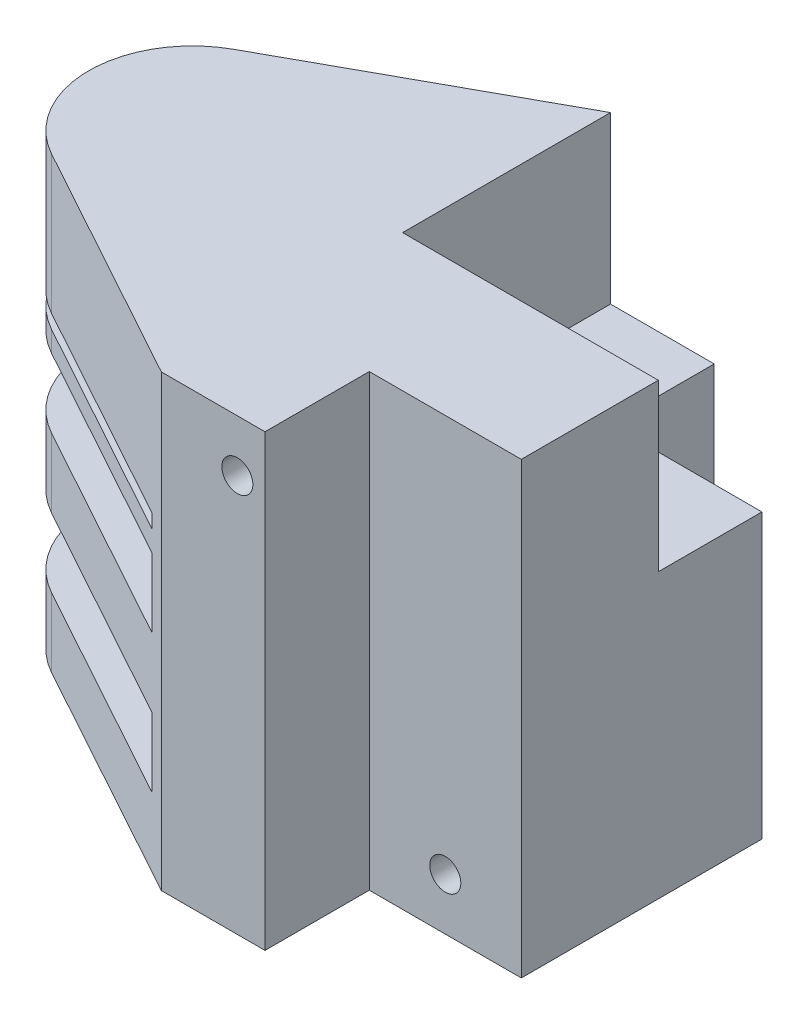
from build123d import *

# Parameters (mm, degrees)
SKETCH1_W               = 80
SKETCH1_H               = 65
BOSS_EXTRUDE1_DEPTH     = 65
SKETCH3_W               = 22
SKETCH3_H               = 15.09
CUT_EXTRUDE1_DEPTH      = 65.72
CUT_EXTRUDE2_DEPTH      = 20
CUT_EXTRUDE2_DEPTH_BACK = 55.72
SKETCH4_R               = 2.24505
SKETCH4_R_2             = 2.245
SKETCH5_W               = 65
SKETCH5_H               = 10
SKETCH5_H_2             = 2
CUT_EXTRUDE3_DEPTH      = 40
SKETCH23_W              = 37
SKETCH23_H              = 30.09
CUT_EXTRUDE15_DEPTH     = 24
CUT_EXTRUDE4_DEPTH      = 65
SKETCH10_R              = 1
CUT_EXTRUDE6_DEPTH      = 42


with BuildPart() as part:
    # Sketch1 → Boss-Extrude1 (new body)
    with BuildSketch(Plane.XY):
        with Locations((40, 32.5)):
            Rectangle(SKETCH1_W, SKETCH1_H)
    extrude(amount=BOSS_EXTRUDE1_DEPTH)

    # Sketch3 → Cut-Extrude1 (cut)
    with BuildSketch(Plane.XZ):
        with Locations((69, 57.455)):
            Rectangle(SKETCH3_W, SKETCH3_H)
        with Locations((69, 7.545)):
            Rectangle(SKETCH3_W, SKETCH3_H)
    extrude(amount=-CUT_EXTRUDE1_DEPTH, mode=Mode.SUBTRACT)

    # Sketch4 → Cut-Extrude2 (cut, two sides: drawn at the far end of the back side and taken through both)
    with BuildSketch(Plane.XY.offset(49.91).offset(-CUT_EXTRUDE2_DEPTH_BACK)):
        with Locations((69, 7.5)):
            Circle(SKETCH4_R)
        with Locations((54, 57.5)):
            Circle(SKETCH4_R_2)
    extrude(amount=CUT_EXTRUDE2_DEPTH + CUT_EXTRUDE2_DEPTH_BACK, mode=Mode.SUBTRACT)

    # Sketch5 → Cut-Extrude3 (cut)
    with BuildSketch(Plane.ZY):
        with Locations((32.5, 15)):
            Rectangle(SKETCH5_W, SKETCH5_H)
        with Locations((32.5, 35)):
            Rectangle(SKETCH5_W, SKETCH5_H)
        with Locations((32.5, 44)):
            Rectangle(SKETCH5_W, SKETCH5_H_2)
    extrude(amount=-CUT_EXTRUDE3_DEPTH, mode=Mode.SUBTRACT)

    # Sketch23 → Cut-Extrude15 (cut)
    with BuildSketch(Plane(origin=(0, 65, 0), x_dir=(1, 0, 0), z_dir=(0, 1, 0))):
        with Locations((61.5, -15.045)):
            Rectangle(SKETCH23_W, SKETCH23_H)
    extrude(amount=-CUT_EXTRUDE15_DEPTH, mode=Mode.SUBTRACT)

    # Sketch6 → Cut-Extrude4 (cut)
    with BuildSketch(Plane.XZ):
        with BuildLine():
            Line((0, 0), (43, 0))
            Line((43, 0), (7.776682895, 19.353757571))
            ThreePointArc((7.776682895, 19.353757571), (2.089737482, 24.862911437), (0, 32.5))
            Line((0, 32.5), (0, 0))
        make_face()
        with BuildLine():
            Line((0, 65), (0, 32.5))
            ThreePointArc((0, 32.5), (2.089737482, 40.137088563), (7.776682895, 45.646242429))
            Line((7.776682895, 45.646242429), (43, 65))
            Line((43, 65), (0, 65))
        make_face()
    extrude(amount=-CUT_EXTRUDE4_DEPTH, mode=Mode.SUBTRACT)

    # Sketch10 → Cut-Extrude6 (cut)
    with BuildSketch(Plane.XZ):
        with Locations((15, 32.5)):
            Circle(SKETCH10_R)
    extrude(amount=-CUT_EXTRUDE6_DEPTH, mode=Mode.SUBTRACT)


with BuildPart() as part_1:
    # Body-Move/Copy1: moved
    add(part.part.moved(Location((-15.00003935, 0, -32.58284488))))


with BuildPart() as part_2:
    # Body-Move/Copy2: moved
    add(part_1.part.moved(Location((-53.99996065, -7.5, 0))))


solid = part_2.part
